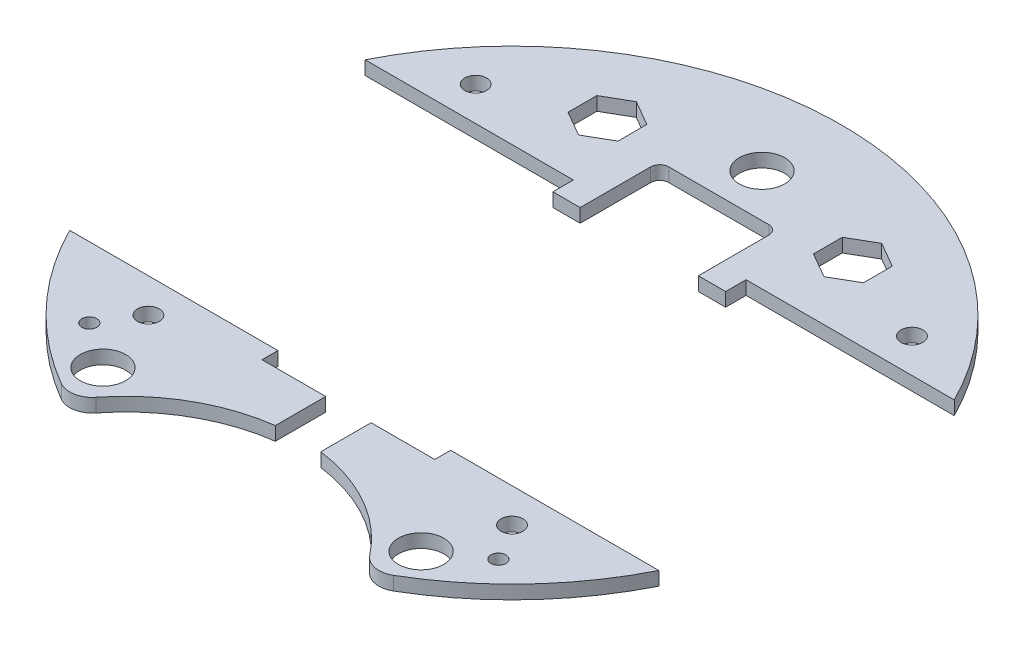
from build123d import *

# Parameters (mm, degrees)
BOSS_EXTRUDE1_DEPTH      = 3
SOLENOID_PLACEMENT_W     = 38
SOLENOID_PLACEMENT_H     = 64
CUT_EXTRUDE1_DEPTH       = 103.574363269
CUT_EXTRUDE4_DEPTH       = 103.574363269
CUT_EXTRUDE5_DEPTH       = 103.574363269
SKETCH6_R                = 2.4
CUT_EXTRUDE6_DEPTH       = 103.574363269
CUT_EXTRUDE3_DEPTH       = 103.574363269
SKETCH7_W                = 10
SKETCH7_H                = 50
CUT_EXTRUDE7_DEPTH       = 98.289516393
SKETCH9_R                = 5
CUT_EXTRUDE11_DEPTH      = 98.289516393
CUT_EXTRUDE12_DEPTH      = 98.289516393
CUT_EXTRUDE12_DEPTH_BACK = 98.289516393
SKETCH10_R               = 5
SKETCH11_R               = 1.65
CUT_EXTRUDE13_DEPTH      = 98.289516393


with BuildPart() as part:
    # Sketch1 → Boss-Extrude1 (new body)
    with BuildSketch(Plane(origin=(0, 0, 0), x_dir=(1, 0, 0), z_dir=(0, 1, 0))):
        with BuildLine():
            ThreePointArc((36.543377003, -62.616544118), (0, 72.5), (-36.543377003, -62.616544118))
            ThreePointArc((-36.543377003, -62.616544118), (-33.085954668, -63.20954405), (-30.089832649, -61.38507948))
            ThreePointArc((-30.089832649, -61.38507948), (0, -46.75), (30.089832649, -61.38507948))
            ThreePointArc((30.089832649, -61.38507948), (33.085954668, -63.20954405), (36.543377003, -62.616544118))
        make_face()
    extrude(amount=BOSS_EXTRUDE1_DEPTH)

    # solenoid placement → Cut-Extrude1 (cut, through all)
    with BuildSketch(Plane(origin=(0, 3, 0), x_dir=(1, 0, 0), z_dir=(0, 1, 0))):
        with Locations((0, -4)):
            Rectangle(SOLENOID_PLACEMENT_W, SOLENOID_PLACEMENT_H)
    extrude(amount=-CUT_EXTRUDE1_DEPTH, mode=Mode.SUBTRACT)

    # Sketch4 → Cut-Extrude4 (cut, through all)
    with BuildSketch(Plane(origin=(0, 3, 0), x_dir=(1, 0, 0), z_dir=(0, 1, 0))):
        with BuildLine():
            Line((-13, 28), (13, 28))
            Line((13, 28), (13, 43.5))
            ThreePointArc((13, 43.5), (12.414213562, 44.914213562), (11, 45.5))
            Line((11, 45.5), (-11, 45.5))
            ThreePointArc((-11, 45.5), (-12.414213562, 44.914213562), (-13, 43.5))
            Line((-13, 43.5), (-13, 28))
        make_face()
    extrude(amount=-CUT_EXTRUDE4_DEPTH, mode=Mode.SUBTRACT)

    # Sketch5 → Cut-Extrude5 (cut, through all)
    with BuildSketch(Plane(origin=(0, 3, 0), x_dir=(1, 0, 0), z_dir=(0, 1, 0))):
        Polygon((-21.5, 51.175426481), (-27, 54.350852961), (-32.5, 51.175426481), (-32.5, 44.824573519), (-27, 41.649147039), (-21.5, 44.824573519), align=None)
        Polygon((21.5, 44.824573519), (21.5, 51.175426481), (27, 54.350852961), (32.5, 51.175426481), (32.5, 44.824573519), (27, 41.649147039), align=None)
    extrude(amount=-CUT_EXTRUDE5_DEPTH, mode=Mode.SUBTRACT)

    # Sketch6 → Cut-Extrude6 (cut, through all)
    with BuildSketch(Plane(origin=(0, 3, 0), x_dir=(1, 0, 0), z_dir=(0, 1, 0))):
        with Locations((40, -40)):
            Circle(SKETCH6_R)
        with Locations((-40, -40)):
            Circle(SKETCH6_R)
        with Locations((48, 40)):
            Circle(SKETCH6_R)
        with Locations((-48, 40)):
            Circle(SKETCH6_R)
    extrude(amount=-CUT_EXTRUDE6_DEPTH, mode=Mode.SUBTRACT)

    # Sketch3 → Cut-Extrude3 (cut, through all)
    with BuildSketch(Plane(origin=(0, 3, 0), x_dir=(1, 0, 0), z_dir=(0, 1, 0))):
        Polygon((-19, 28), (-19, 32.5), (-72.5, 32.5), (-72.5, -32.5), (72.5, -32.5), (72.5, 32.5), (19, 32.5), (19, 28), align=None)
    extrude(amount=-CUT_EXTRUDE3_DEPTH, mode=Mode.SUBTRACT)


with BuildPart() as cut_extrude3_piece_1:
    # of the separate pieces the step leaves, piece 1, a body of its own (cut_extrude3_pieces)
    add(part.part.solids().sort_by_distance((64.807406984, 0, -32.5))[0])

    # Sketch10 → Cut-Extrude12 (cut, two sides: drawn at the far end of the back side and taken through both)
    with BuildSketch(Plane(origin=(0, 3, 0), x_dir=(1, 0, 0), z_dir=(0, 1, 0)).offset(-CUT_EXTRUDE12_DEPTH_BACK)):
        with Locations((0, 55)):
            Circle(SKETCH10_R)
    extrude(amount=CUT_EXTRUDE12_DEPTH + CUT_EXTRUDE12_DEPTH_BACK, mode=Mode.SUBTRACT)


with BuildPart() as cut_extrude3_piece_2:
    # of the separate pieces the step leaves, piece 2, a body of its own (cut_extrude3_pieces)
    add(part.part.solids().sort_by_distance((-36.543377003, 0, 62.616544118))[0])

    # Sketch7 → Cut-Extrude7 (cut, through all)
    with BuildSketch(Plane(origin=(0, 3, 0), x_dir=(1, 0, 0), z_dir=(0, 1, 0))):
        with Locations((0, -25)):
            Rectangle(SKETCH7_W, SKETCH7_H)
    extrude(amount=-CUT_EXTRUDE7_DEPTH, mode=Mode.SUBTRACT)


with BuildPart() as cut_extrude7_piece_1:
    # of the separate pieces the step leaves, piece 1, a body of its own (cut_extrude7_pieces)
    add(cut_extrude3_piece_2.part.solids().sort_by_distance((-36.543377003, 0, 62.616544118))[0])


with BuildPart() as cut_extrude7_piece_2:
    # of the separate pieces the step leaves, piece 2, a body of its own (cut_extrude7_pieces)
    add(cut_extrude3_piece_2.part.solids().sort_by_distance((5, 0, 47.078205475))[0])


with BuildPart() as cut_extrude11_tool:
    # Sketch9 → Cut-Extrude11 (new, through all)
    with BuildSketch(Plane.XZ.offset(-3)):
        with Locations((35, 55)):
            Circle(SKETCH9_R)
        with Locations((-35, 55)):
            Circle(SKETCH9_R)
    extrude(amount=CUT_EXTRUDE11_DEPTH)


with BuildPart() as cut_extrude7_piece_1_1:
    add(cut_extrude7_piece_1.part)

    # Cut-Extrude11: cut by cut_extrude11_tool
    add(cut_extrude11_tool.part, mode=Mode.SUBTRACT)


with BuildPart() as cut_extrude7_piece_2_1:
    add(cut_extrude7_piece_2.part)

    # Cut-Extrude11: cut by cut_extrude11_tool
    add(cut_extrude11_tool.part, mode=Mode.SUBTRACT)


with BuildPart() as cut_extrude13_tool:
    # Sketch11 → Cut-Extrude13 (new, through all)
    with BuildSketch(Plane(origin=(0, 3, 0), x_dir=(1, 0, 0), z_dir=(0, 1, 0))):
        with Locations((45, -48)):
            Circle(SKETCH11_R)
        with Locations((-45, -48)):
            Circle(SKETCH11_R)
    extrude(amount=-CUT_EXTRUDE13_DEPTH)


with BuildPart() as cut_extrude7_piece_1_2:
    add(cut_extrude7_piece_1_1.part)

    # Cut-Extrude13: cut by cut_extrude13_tool
    add(cut_extrude13_tool.part, mode=Mode.SUBTRACT)


with BuildPart() as cut_extrude7_piece_2_2:
    add(cut_extrude7_piece_2_1.part)

    # Cut-Extrude13: cut by cut_extrude13_tool
    add(cut_extrude13_tool.part, mode=Mode.SUBTRACT)


solid = Compound([cut_extrude3_piece_1.part, cut_extrude7_piece_1_2.part, cut_extrude7_piece_2_2.part])
